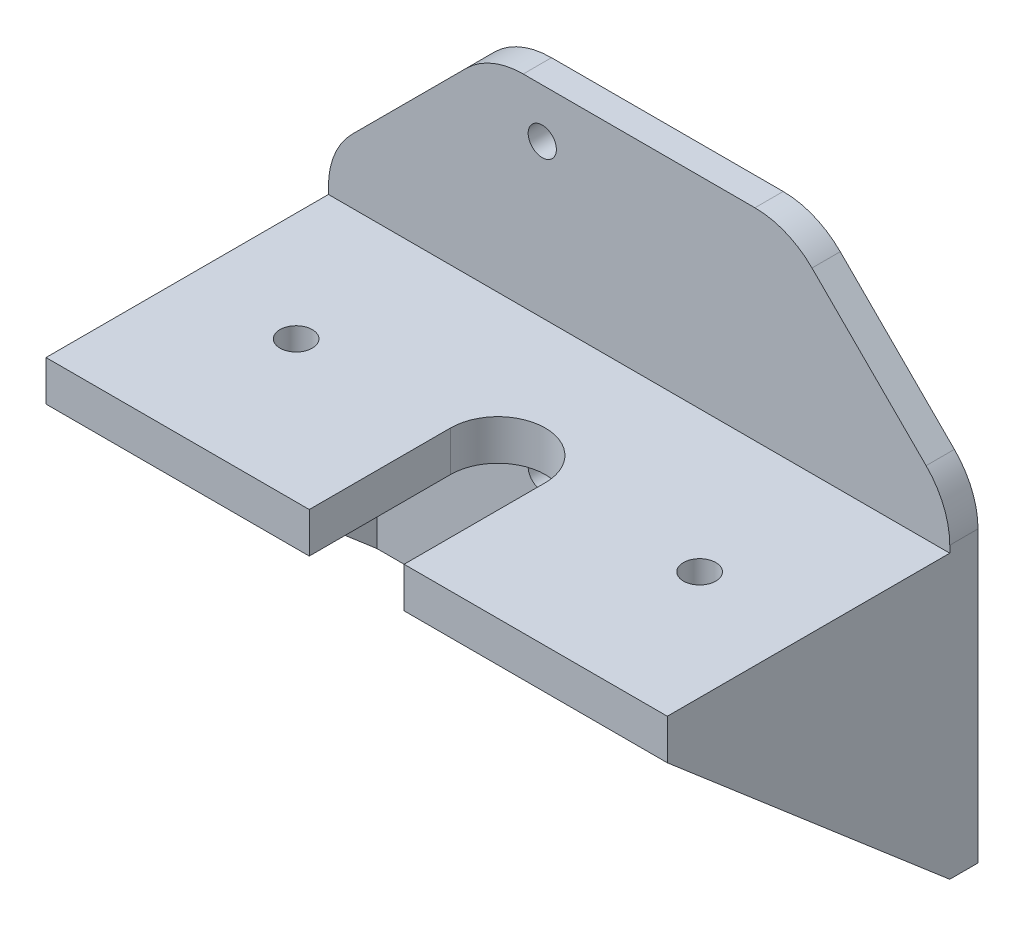
from build123d import *

# Parameters (mm, degrees)
SKETCH1_W           = 77
SKETCH1_H           = 60
SKETCH1_R           = 1.75
BOSS_EXTRUDE1_DEPTH = 3.5
SKETCH2_W           = 77
SKETCH2_H           = 5
BOSS_EXTRUDE2_DEPTH = 35
CUT_EXTRUDE1_DEPTH  = 20
SKETCH4_R           = 2
CUT_EXTRUDE2_DEPTH  = 20
RIB2_REACH          = 97.722
SKETCH5_WALL_W      = 239.541421582
SKETCH5_WALL_H      = 6
CHAMFER1_SIZE       = 20
FILLET1_R           = 10


with BuildPart() as part:
    # Sketch1 → Boss-Extrude1 (new body)
    with BuildSketch(Plane.XY):
        with Locations((-12, 11.85)):
            Rectangle(SKETCH1_W, SKETCH1_H)
        with Locations((-24, 35.8)):
            Circle(SKETCH1_R, mode=Mode.SUBTRACT)
        with Locations((-24, 0)):
            Circle(SKETCH1_R, mode=Mode.SUBTRACT)
        Circle(SKETCH1_R, mode=Mode.SUBTRACT)
    extrude(amount=BOSS_EXTRUDE1_DEPTH)

    # Sketch2 → Boss-Extrude2 (add)
    with BuildSketch(Plane.XY.offset(3.5)):
        with Locations((-12, 14.35)):
            Rectangle(SKETCH2_W, SKETCH2_H)
    extrude(amount=BOSS_EXTRUDE2_DEPTH)

    # Sketch3 → Cut-Extrude1 (cut)
    with BuildSketch(Plane(origin=(0, 16.85, 0), x_dir=(1, 0, 0), z_dir=(0, 1, 0))):
        with BuildLine():
            Line((-17.875, -21), (-17.875, -38.5))
            Line((-17.875, -38.5), (-6.125, -38.5))
            Line((-6.125, -38.5), (-6.125, -21))
            ThreePointArc((-6.125, -21), (-12, -15.125), (-17.875, -21))
        make_face()
    extrude(amount=-CUT_EXTRUDE1_DEPTH, mode=Mode.SUBTRACT)

    # Sketch4 → Cut-Extrude2 (cut)
    with BuildSketch(Plane(origin=(0, 16.85, 0), x_dir=(1, 0, 0), z_dir=(0, 1, 0))):
        with Locations((13, -21)):
            Circle(SKETCH4_R)
        with Locations((-37, -21)):
            Circle(SKETCH4_R)
    extrude(amount=-CUT_EXTRUDE2_DEPTH, mode=Mode.SUBTRACT)

    # Sketch5 wall → Rib2 (add, up to next)
    with BuildSketch(Plane(origin=(26.5, -3.15, 21), x_dir=(0, -0.650791373456, -0.759256602365), z_dir=(0, 0.759256602365, -0.650791373456)), mode=Mode.PRIVATE) as rib2_sk1:
        with Locations((0, 3)):
            Rectangle(SKETCH5_WALL_W, SKETCH5_WALL_H)
    rib2_tool1 = extrude(rib2_sk1.sketch, amount=RIB2_REACH, mode=Mode.PRIVATE) - part.part
    rib2 = rib2_tool1.solids().sort_by_distance((26.5, -3.15, 21))[0]
    add(rib2)

    # Mirror1: Rib2 across plane
    add(rib2.mirror(Plane(origin=(-12, 0, 0), x_dir=(0, 0, 1), z_dir=(1, 0, 0))))

    # Chamfer1
    chamfer1_edges = [part.edges().sort_by_distance(p)[0] for p in [
        (-50.5, 41.85, 1.75),
        (26.5, 41.85, 1.75),
    ]]
    chamfer(chamfer1_edges, length=CHAMFER1_SIZE)

    # Fillet1
    fillet1_edges = [part.edges().sort_by_distance(p)[0] for p in [
        (-50.5, 21.85, 1.75),
        (-30.5, 41.85, 1.75),
        (26.5, 21.85, 1.75),
        (6.5, 41.85, 1.75),
    ]]
    fillet(fillet1_edges, radius=FILLET1_R)


solid = part.part
